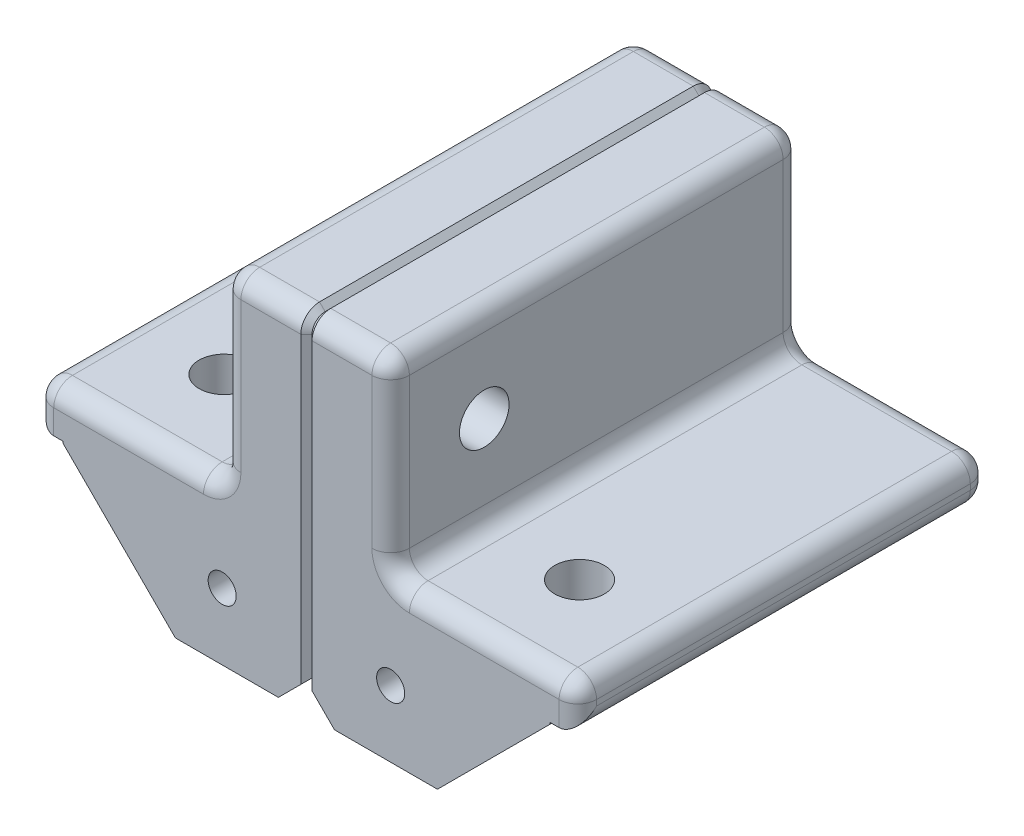
from build123d import *

# Parameters (mm, degrees)
BOSS_EXTRUDE1_START         = -43.935349693
BOSS_EXTRUDE1_DEPTH         = 28.435349693
BOSS_EXTRUDE1_2_OUTLINE_R   = 2.55
BOSS_EXTRUDE1_2_DEPTH       = 14.563454094
BOSS_EXTRUDE1_START_2       = -4.434895226
BOSS_EXTRUDE1_3_DEPTH       = 4.434895226
BOSS_EXTRUDE1_START_3       = -18.763494474
BOSS_EXTRUDE1_4_OUTLINE_R   = 2.55
BOSS_EXTRUDE1_4_DEPTH       = 2.828599076
BOSS_EXTRUDE1_START_4       = -4.5
BOSS_EXTRUDE1_5_DEPTH       = 0.065104774
BOSS_EXTRUDE1_START_5       = -15.934895398
BOSS_EXTRUDE1_6_DEPTH       = 11.500000172
BOSS_EXTRUDE1_START_6       = 141
BOSS_EXTRUDE1_7_DEPTH       = 9
BOSS_EXTRUDE1_START_7       = 162.650002384
BOSS_EXTRUDE1_8_OUTLINE_W   = 4.6
BOSS_EXTRUDE1_8_OUTLINE_H   = 11
BOSS_EXTRUDE1_8_DEPTH       = 7.349997616
BOSS_EXTRUDE1_START_8       = 145
BOSS_EXTRUDE1_9_OUTLINE_R   = 5.5
BOSS_EXTRUDE1_9_OUTLINE_R_2 = 2.65
BOSS_EXTRUDE1_9_DEPTH       = 5
BOSS_EXTRUDE1_START_9       = 150
BOSS_EXTRUDE1_10_OUTLINE_W  = 2.8
BOSS_EXTRUDE1_10_OUTLINE_H  = 11
BOSS_EXTRUDE1_10_DEPTH      = 7.350002384
BOSS_EXTRUDE1_START_10      = 154.000001155
BOSS_EXTRUDE1_11_OUTLINE_W  = 1.8
BOSS_EXTRUDE1_11_OUTLINE_H  = 11
BOSS_EXTRUDE1_11_DEPTH      = 3.350001229
BOSS_EXTRUDE1_START_11      = 150.4
BOSS_EXTRUDE1_12_DEPTH      = 4.6
BOSS_EXTRUDE1_START_12      = -47.065105608
BOSS_EXTRUDE1_13_DEPTH      = 11
SKETCH3_W                   = 6.451160056
SKETCH3_H                   = 6.067672212
BOSS_EXTRUDE2_DEPTH         = 2.828599076
SKETCH4_W                   = 7.719174318
SKETCH4_H                   = 7.098939164
BOSS_EXTRUDE3_DEPTH         = 14.563454094
CUT_EXTRUDE1_REACH          = 249.902
SKETCH1_R                   = 1.5
FILLET1_R                   = 2
CHAMFER1_SIZE               = 0.6


with BuildPart() as part:
    # Boss-Extrude1: read off the stored shape, not the designer's step
    # Boss-Extrude1 outline → Boss-Extrude1 (new body)
    with BuildSketch(Plane.XY.offset(-31.565105608).offset(BOSS_EXTRUDE1_START)):
        Polygon((154.000001155, 150.4), (170, 150.4), (170, 155), (150, 155), (150, 175), (141, 175), (141, 152.2), (153.000001155, 152.2), (154.000001155, 151.2), align=None)
    extrude(amount=BOSS_EXTRUDE1_DEPTH)

    # Boss-Extrude1 2 outline → Boss-Extrude1 2 (add)
    with BuildSketch(Plane.XY.offset(-31.565105608).offset(BOSS_EXTRUDE1_START)):
        Polygon((141, 141.2), (144, 138.2), (155.00000231, 138.2), (155.00000231, 150.4), (154.000001155, 150.4), (154.000001155, 151.2), (153.000001155, 152.2), (141, 152.2), align=None)
        with Locations((148.500000052, 143.805749978)):
            Circle(BOSS_EXTRUDE1_2_OUTLINE_R, mode=Mode.SUBTRACT)
    extrude(amount=BOSS_EXTRUDE1_2_DEPTH)

    # Boss-Extrude1 4 outline → Boss-Extrude1 4 (add)
    with BuildSketch(Plane.XY.offset(-31.565105608).offset(BOSS_EXTRUDE1_START_3)):
        Polygon((141, 141.2), (144, 138.2), (155.00000231, 138.2), (167.00000231, 150.2), (167.00000231, 150.4), (154.000001155, 150.4), (154.000001155, 151.2), (153.000001155, 152.2), (141, 152.2), align=None)
        with Locations((148.500000052, 143.805749978)):
            Circle(BOSS_EXTRUDE1_4_OUTLINE_R, mode=Mode.SUBTRACT)
    extrude(amount=BOSS_EXTRUDE1_4_DEPTH)



with BuildPart() as body_2:
    # Boss-Extrude1 3 outline → Boss-Extrude1 3 (new body)
    with BuildSketch(Plane.XY.offset(-31.565105608).offset(BOSS_EXTRUDE1_START_2)):
        Polygon((141, 141.2), (144, 138.2), (155.00000231, 138.2), (167.00000231, 150.2), (167.00000231, 150.4), (170, 150.4), (170, 155), (150, 155), (150, 175), (141, 175), align=None)
    extrude(amount=BOSS_EXTRUDE1_3_DEPTH)

    # Boss-Extrude1 5 outline → Boss-Extrude1 5 (add)
    with BuildSketch(Plane.XY.offset(-31.565105608).offset(BOSS_EXTRUDE1_START_4)):
        Polygon((154.000001155, 150.4), (170, 150.4), (170, 155), (150, 155), (150, 175), (141, 175), (141, 152.2), (152.500001155, 152.2), (154.000001155, 150.7), align=None)
    extrude(amount=BOSS_EXTRUDE1_5_DEPTH)


with BuildPart() as part_1:
    add(part.part)

    add(body_2.part)  # Boss-Extrude1 6 merges body 2
    # Boss-Extrude1 6 outline → Boss-Extrude1 6 (add)
    with BuildSketch(Plane.XY.offset(-31.565105608).offset(BOSS_EXTRUDE1_START_5)):
        Polygon((153.000001155, 152.2), (152.500001155, 152.2), (154.000001155, 150.7), (154.000001155, 151.2), align=None)
    extrude(amount=BOSS_EXTRUDE1_6_DEPTH)

    # Boss-Extrude1 7 outline → Boss-Extrude1 7 (add)
    with BuildSketch(Plane.YZ.offset(BOSS_EXTRUDE1_START_6)):
        with BuildLine():
            Line((152.2, -36.065105608), (152.2, -47.065105608))
            Line((152.2, -47.065105608), (165, -47.065105608))
            ThreePointArc((165, -47.065105608), (159.5, -41.565105608), (165, -36.065105608))
            Line((165, -36.065105608), (152.2, -36.065105608))
        make_face()
        with BuildLine():
            Line((175, -36.065105608), (165, -36.065105608))
            ThreePointArc((165, -36.065105608), (170.5, -41.565105608), (165, -47.065105608))
            Line((165, -47.065105608), (175, -47.065105608))
            Line((175, -47.065105608), (175, -36.065105608))
        make_face()
    extrude(amount=BOSS_EXTRUDE1_7_DEPTH)

    # Boss-Extrude1 8 outline → Boss-Extrude1 8 (add)
    with BuildSketch(Plane.YZ.offset(BOSS_EXTRUDE1_START_7)):
        with Locations((152.7, -41.565105608)):
            Rectangle(BOSS_EXTRUDE1_8_OUTLINE_W, BOSS_EXTRUDE1_8_OUTLINE_H)
    extrude(amount=BOSS_EXTRUDE1_8_DEPTH)

    # Boss-Extrude1 9 outline → Boss-Extrude1 9 (add)
    with BuildSketch(Plane.YZ.offset(BOSS_EXTRUDE1_START_8)):
        with Locations((165, -41.565105608)):
            Circle(BOSS_EXTRUDE1_9_OUTLINE_R)
        with Locations((165, -41.565105608)):
            Circle(BOSS_EXTRUDE1_9_OUTLINE_R_2, mode=Mode.SUBTRACT)
    extrude(amount=BOSS_EXTRUDE1_9_DEPTH)

    # Boss-Extrude1 10 outline → Boss-Extrude1 10 (add)
    with BuildSketch(Plane.YZ.offset(BOSS_EXTRUDE1_START_9)):
        with Locations((153.6, -41.565105608)):
            Rectangle(BOSS_EXTRUDE1_10_OUTLINE_W, BOSS_EXTRUDE1_10_OUTLINE_H)
    extrude(amount=BOSS_EXTRUDE1_10_DEPTH)

    # Boss-Extrude1 11 outline → Boss-Extrude1 11 (add)
    with BuildSketch(Plane.YZ.offset(BOSS_EXTRUDE1_START_10)):
        with Locations((151.3, -41.565105608)):
            Rectangle(BOSS_EXTRUDE1_11_OUTLINE_W, BOSS_EXTRUDE1_11_OUTLINE_H)
    extrude(amount=BOSS_EXTRUDE1_11_DEPTH)

    # Boss-Extrude1 12 outline → Boss-Extrude1 12 (add)
    with BuildSketch(Plane(origin=(0, 0, 0), x_dir=(1, 0, 0), z_dir=(0, 1, 0)).offset(BOSS_EXTRUDE1_START_11)):
        with BuildLine():
            Line((162.650002384, 36.065105608), (162.650002384, 41.750000771))
            ThreePointArc((162.650002384, 41.750000771), (160.000002384, 39.100000771), (157.350002384, 41.750000771))
            Line((157.350002384, 41.750000771), (157.350002384, 36.065105608))
            Line((157.350002384, 36.065105608), (162.650002384, 36.065105608))
        make_face()
        with BuildLine():
            ThreePointArc((157.350002384, 41.750000771), (160.000002384, 44.400000771), (162.650002384, 41.750000771))
            Line((162.650002384, 41.750000771), (162.650002384, 47.065105608))
            Line((162.650002384, 47.065105608), (157.350002384, 47.065105608))
            Line((157.350002384, 47.065105608), (157.350002384, 41.750000771))
        make_face()
    extrude(amount=BOSS_EXTRUDE1_12_DEPTH)

    # Boss-Extrude1 13 outline → Boss-Extrude1 13 (add)
    with BuildSketch(Plane.XY.offset(BOSS_EXTRUDE1_START_12)):
        Polygon((154.000001155, 151.2), (154.000001155, 152.2), (153.000001155, 152.2), align=None)
    extrude(amount=BOSS_EXTRUDE1_13_DEPTH)

    # Sketch3 → Boss-Extrude2 (add)
    with BuildSketch(Plane.XY.offset(-47.500001006)):
        with Locations((148.73897812, 143.568973674)):
            Rectangle(SKETCH3_W, SKETCH3_H)
    extrude(amount=-BOSS_EXTRUDE2_DEPTH)

    # Sketch4 → Boss-Extrude3 (add)
    with BuildSketch(Plane.XY.offset(-60.937001207)):
        with Locations((148.978547937, 144.39743248)):
            Rectangle(SKETCH4_W, SKETCH4_H)
    extrude(amount=-BOSS_EXTRUDE3_DEPTH)

    # Sketch1 → Cut-Extrude1 (cut, up to next)
    with BuildSketch(Plane.XY.offset(-31.565105608), mode=Mode.PRIVATE) as cut_extrude1_sk1:
        with Locations((150.000000052, 145.305749978)):
            Circle(SKETCH1_R)
    cut_extrude1_tool1 = extrude(cut_extrude1_sk1.sketch, amount=-CUT_EXTRUDE1_REACH, mode=Mode.PRIVATE) & part_1.part
    add(cut_extrude1_tool1.solids().sort_by_distance((150, 145.30575, -31.565106))[0], mode=Mode.SUBTRACT)
    add(cut_extrude1_tool1.solids().sort_by_distance((150, 145.30575, -31.565106))[1], mode=Mode.SUBTRACT)
    add(cut_extrude1_tool1.solids().sort_by_distance((150, 145.30575, -31.565106))[2], mode=Mode.SUBTRACT)

    # Fillet1
    fillet1_edges = [part_1.edges().sort_by_distance(p)[0] for p in [
        (145.5, 175, -31.565105608),
        (170, 152.7, -75.500455301),
        (170, 152.7, -31.565105608),
        (170, 150.4, -53.532780455),
        (155.00000231, 144.3, -75.500455301),
        (149.500001155, 138.2, -75.500455301),
        (162.500001155, 150.4, -75.500455301),
        (155.00000231, 138.2, -68.218728254),
        (155.00000231, 150.4, -68.218728254),
        (150, 165, -75.500455301),
        (150, 175, -53.532780455),
        (150, 165, -31.565105608),
        (150, 155, -53.532780455),
        (160, 155, -75.500455301),
        (160, 155, -31.565105608),
        (170, 155, -53.532780455),
        (145.5, 175, -75.500455301),
    ]]
    fillet(fillet1_edges, radius=FILLET1_R)

    # Chamfer1
    chamfer1_edges = [part_1.edges().sort_by_distance(p)[0] for p in [
        (141, 146.7, -60.937001207),
        (141, 152.2, -55.632800645),
        (141, 146.7, -36.000000834),
        (141, 157.1, -31.565105608),
        (141, 165, -47.065105608),
        (141, 157.1, -75.500455301),
        (141, 175, -53.532780455),
        (141, 174.414213562, -74.914668863),
        (141, 174.414213562, -32.150892046),
        (141, 146.7, -47.500001006),
        (141, 152.2, -41.75000092),
    ]]
    chamfer(chamfer1_edges, length=CHAMFER1_SIZE)


with BuildPart() as body_2_2:
    # Mirror1: mirrored copy
    add(part_1.part.mirror(Plane(origin=(141, 156.6, -48.751280455), x_dir=(0, 0, 1), z_dir=(-1, 0, 0))))


solid = Compound([part_1.part, body_2_2.part])
